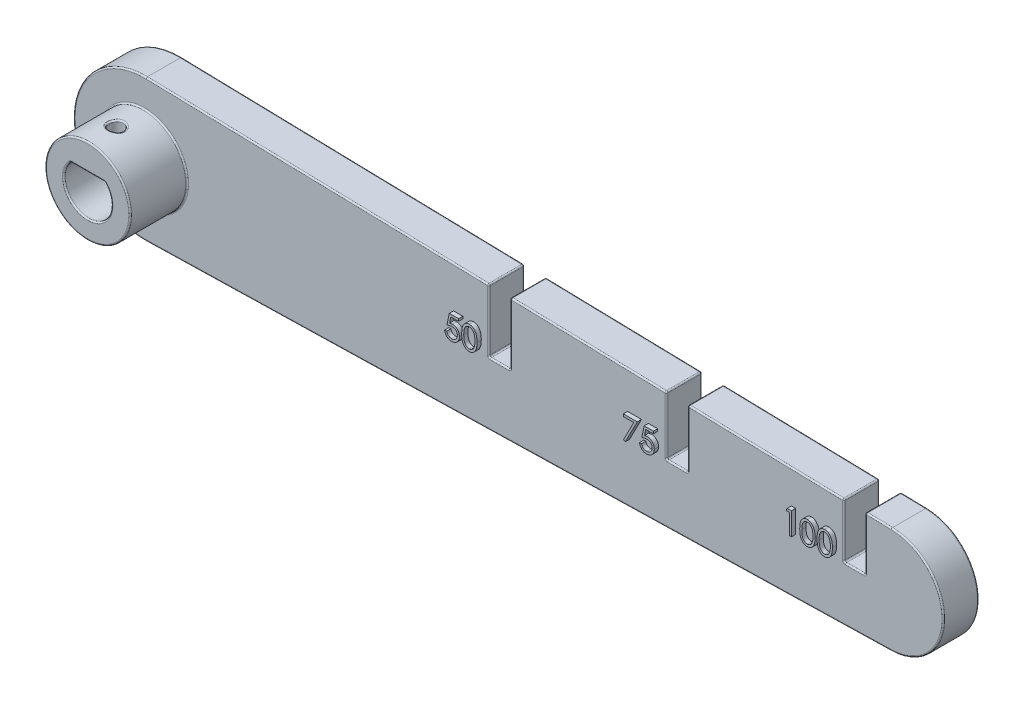
from build123d import *

# Parameters (mm, degrees)
BOSS_EXTRUDE1_DEPTH = 5
CUT_EXTRUDE2_REACH  = 115.054
CUT_EXTRUDE3_REACH  = 115.054
SKETCH4_W           = 3
SKETCH4_H           = 7.656932545
SKETCH4_H_2         = 8.25233943
SKETCH4_H_3         = 8.847746315
SKETCH6_R           = 6
BOSS_EXTRUDE3_DEPTH = 8
CUT_EXTRUDE4_REACH  = 115.689
SKETCH7_R           = 1
FILLET1_R           = 0.2
BOSS_EXTRUDE2_DEPTH = 0.6


with BuildPart() as part:
    # Sketch3 → Boss-Extrude1 (new body)
    with BuildSketch(Plane.XY):
        with BuildLine():
            Line((0.238095238, 9.997165131), (105.178571429, 7.497873848))
            ThreePointArc((105.178571429, 7.497873848), (112.5, 0), (105.178571429, -7.497873848))
            Line((105.178571429, -7.497873848), (0.238095238, -9.997165131))
            ThreePointArc((0.238095238, -9.997165131), (-10, 0), (0.238095238, 9.997165131))
        make_face()
    extrude(amount=BOSS_EXTRUDE1_DEPTH)

    # Sketch2 → Cut-Extrude2 (cut, up to next)
    with BuildSketch(Plane.XY, mode=Mode.PRIVATE) as cut_extrude2_sk1:
        with BuildLine():
            Line((-2.4, 2.337199179), (2.4, 2.337199179))
            ThreePointArc((2.4, 2.337199179), (0, -3.35), (-2.4, 2.337199179))
        make_face()
    cut_extrude2_tool1 = extrude(cut_extrude2_sk1.sketch, amount=CUT_EXTRUDE2_REACH, mode=Mode.PRIVATE) & part.part
    add(cut_extrude2_tool1.solids().sort_by_distance((0, -0.288877, 0))[0], mode=Mode.SUBTRACT)

    # Sketch4 → Cut-Extrude3 (cut, up to next)
    with BuildSketch(Plane.XY.offset(5), mode=Mode.PRIVATE) as cut_extrude3_sk1:
        with Locations((100, 3.828466273)):
            Rectangle(SKETCH4_W, SKETCH4_H)
    cut_extrude3_tool1 = extrude(cut_extrude3_sk1.sketch, amount=-CUT_EXTRUDE3_REACH, mode=Mode.PRIVATE) & part.part
    # Sketch4 → Cut-Extrude3 (cut, up to next)
    with BuildSketch(Plane.XY.offset(5), mode=Mode.PRIVATE) as cut_extrude3_sk2:
        with Locations((75, 4.126169715)):
            Rectangle(SKETCH4_W, SKETCH4_H_2)
    cut_extrude3_tool2 = extrude(cut_extrude3_sk2.sketch, amount=-CUT_EXTRUDE3_REACH, mode=Mode.PRIVATE) & part.part
    # Sketch4 → Cut-Extrude3 (cut, up to next)
    with BuildSketch(Plane.XY.offset(5), mode=Mode.PRIVATE) as cut_extrude3_sk3:
        with Locations((50, 4.423873158)):
            Rectangle(SKETCH4_W, SKETCH4_H_3)
    cut_extrude3_tool3 = extrude(cut_extrude3_sk3.sketch, amount=-CUT_EXTRUDE3_REACH, mode=Mode.PRIVATE) & part.part
    add(cut_extrude3_tool1.solids().sort_by_distance((100, 3.828466, 5))[0], mode=Mode.SUBTRACT)
    add(cut_extrude3_tool2.solids().sort_by_distance((75, 4.12617, 5))[0], mode=Mode.SUBTRACT)
    add(cut_extrude3_tool3.solids().sort_by_distance((50, 4.423873, 5))[0], mode=Mode.SUBTRACT)

    # Sketch6 → Boss-Extrude3 (add)
    with BuildSketch(Plane.XY.offset(5)):
        Circle(SKETCH6_R)
        with BuildLine():
            Line((-2.4, 2.337199179), (2.4, 2.337199179))
            ThreePointArc((2.4, 2.337199179), (0, -3.35), (-2.4, 2.337199179))
        make_face(mode=Mode.SUBTRACT)
    extrude(amount=BOSS_EXTRUDE3_DEPTH)

    # Sketch7 → Cut-Extrude4 (cut, up to next)
    with BuildSketch(Plane(origin=(0, 0, 0), x_dir=(1, 0, 0), z_dir=(0, 1, 0)), mode=Mode.PRIVATE) as cut_extrude4_sk1:
        with Locations((0, -9)):
            Circle(SKETCH7_R)
    cut_extrude4_tool1 = extrude(cut_extrude4_sk1.sketch, amount=CUT_EXTRUDE4_REACH, mode=Mode.PRIVATE) & part.part
    add(cut_extrude4_tool1.solids().sort_by_distance((0, 0, 9))[0], mode=Mode.SUBTRACT)

    # Fillet1
    fillet1_edges = [part.edges().sort_by_distance(p)[0] for p in [
        (51.5, 0, 2.5),
        (48.5, 0, 2.5),
        (101.5, 0, 2.5),
        (98.5, 0, 2.5),
        (76.5, 0, 2.5),
        (73.5, 0, 2.5),
        (0, 2.337199179, 0),
        (0, -3.35, 0),
        (76.5, 4.090445302, 0),
        (75, 0, 0),
        (73.5, 4.126169715, 0),
        (62.5, 8.51431846, 0),
        (51.5, 4.388148745, 0),
        (50, 0, 0),
        (48.5, 4.423873158, 0),
        (24.369047619, 9.422455723, 0),
        (-10, 0, 0),
        (52.708333333, -8.74751949, 0),
        (112.5, 0, 0),
        (103.339285714, 7.541678783, 0),
        (101.5, 3.792741859, 0),
        (100, 0, 0),
        (98.5, 3.828466272, 0),
        (87.5, 7.918911574, 0),
        (100, 0, 5),
        (101.5, 3.792741859, 5),
        (103.339285714, 7.541678783, 5),
        (112.5, 0, 5),
        (52.708333333, -8.74751949, 5),
        (-10, 0, 5),
        (24.369047619, 9.422455723, 5),
        (48.5, 4.423873158, 5),
        (50, 0, 5),
        (51.5, 4.388148745, 5),
        (62.5, 8.51431846, 5),
        (73.5, 4.126169715, 5),
        (75, 0, 5),
        (76.5, 4.090445302, 5),
        (87.5, 7.918911574, 5),
        (98.5, 3.828466272, 5),
        (101.5, 7.585483719, 2.5),
        (98.5, 7.656932545, 2.5),
        (76.5, 8.180890604, 2.5),
        (73.5, 8.25233943, 2.5),
        (51.5, 8.776297489, 2.5),
        (48.5, 8.847746315, 2.5),
        (-6, 0, 5),
        (0, 2.337199179, 13),
        (2.4, 2.337199179, 6.5),
        (0, -3.35, 13),
        (-2.4, 2.337199179, 6.5),
        (-1.000000007, 5.916079783, 9),
        (-1, 2.337199179, 9),
        (-6, 0, 13),
    ]]
    fillet(fillet1_edges, radius=FILLET1_R)

    # Sketch5 → Boss-Extrude2 (add)
    # profile 1 of 7: a face of its own
    with BuildSketch(Plane.XY.offset(5)):
        with BuildLine():
            Line((44.816666667, 3.175), (44.816666667, 2.849358974))
            Line((44.816666667, 2.849358974), (43.736708734, 2.849358974))
            Line((43.736708734, 2.849358974), (43.565619992, 2.014267829))
            add(Edge.make_bspline(
                [(43.565619992, 2.014267829), (43.599234964, 2.023548147), (43.664358655, 2.041527295), (43.760479386, 2.061489672), (43.851730885, 2.073523325), (43.910944971, 2.075166443), (43.939598357, 2.075961538)],
                knots=[0, 0, 0, 0, 1.100273476, 2.13160584, 3.095893838, 4, 4, 4, 4], degree=3))
            add(Edge.make_bspline(
                [(43.939598357, 2.075961538), (43.975052893, 2.075194154), (44.044765367, 2.073685284), (44.146763555, 2.059196535), (44.244129822, 2.036391041), (44.336660544, 2.004531711), (44.424526901, 1.963792167), (44.506920474, 1.912901507), (44.58507801, 1.853453414), (44.657597363, 1.785104724), (44.723387271, 1.709882972), (44.781232133, 1.629004046), (44.83036534, 1.543253952), (44.869881167, 1.4518134), (44.901435528, 1.355693311), (44.922437695, 1.253882325), (44.936422852, 1.147340102), (44.937985302, 1.074492385), (44.938782051, 1.037344752)],
                knots=[0, 0, 0, 0, 1.052922333, 2.070308379, 3.05430497, 4.020497103, 4.973039431, 5.925935799, 6.892292201, 7.88610001, 8.88166317, 9.857072816, 10.836096531, 11.812156883, 12.81219415, 13.836441305, 14.89672472, 16, 16, 16, 16], degree=3))
            add(Edge.make_bspline(
                [(44.938782051, 1.037344752), (44.938178733, 1.011471023), (44.93698025, 0.960073227), (44.930885531, 0.883742417), (44.919150989, 0.809027561), (44.903395982, 0.735918748), (44.882946788, 0.664554389), (44.858191718, 0.594730218), (44.82789675, 0.526880824), (44.79466686, 0.460364216), (44.757250412, 0.396684142), (44.715722766, 0.337131132), (44.671848356, 0.28081182), (44.624639385, 0.228330219), (44.573657054, 0.180031196), (44.519518798, 0.135628112), (44.462656617, 0.094370048), (44.40219079, 0.057931757), (44.339468681, 0.024401075), (44.273584512, -0.003106705), (44.20603802, -0.027699827), (44.135857025, -0.047302756), (44.063200495, -0.062663002), (43.987948663, -0.073095689), (43.910496198, -0.080694315), (43.857995294, -0.081169982), (43.831475361, -0.081410256)],
                knots=[0, 0, 0, 0, 1.056347294, 2.098418968, 3.122841568, 4.141288669, 5.149314143, 6.15115421, 7.162517403, 8.180376062, 9.185164535, 10.17417709, 11.141909838, 12.097768115, 13.052685741, 14.0056014, 14.954263652, 15.917497458, 16.885230207, 17.854509472, 18.828990115, 19.81800267, 20.826176721, 21.857883937, 22.917946725, 24, 24, 24, 24], degree=3))
            add(Edge.make_bspline(
                [(43.831475361, -0.081410256), (43.799839497, -0.080783568), (43.737599672, -0.079550632), (43.646413157, -0.066652434), (43.558679194, -0.048179453), (43.47510403, -0.02038798), (43.39493867, 0.014434781), (43.319262347, 0.058445879), (43.246141393, 0.10831978), (43.178548331, 0.167175529), (43.115813857, 0.231506183), (43.05965581, 0.301317758), (43.009641779, 0.375458038), (42.96657268, 0.454287077), (42.929835189, 0.537597745), (42.90097445, 0.625702181), (42.877680514, 0.718140042), (42.867825839, 0.781779298), (42.862820513, 0.814102564)],
                knots=[0, 0, 0, 0, 1.0467383, 2.05933395, 3.04377827, 4.011590433, 4.970194871, 5.932262533, 6.905835911, 7.896367577, 8.894135286, 9.877477877, 10.858688626, 11.851381753, 12.8477658, 13.868841284, 14.917554742, 16, 16, 16, 16], degree=3))
            Line((42.862820513, 0.814102564), (43.14775641, 0.814102564))
            add(Edge.make_bspline(
                [(43.14775641, 0.814102564), (43.154767316, 0.783825354), (43.168242666, 0.725630874), (43.197820738, 0.643868872), (43.233984782, 0.571007861), (43.276987298, 0.506084025), (43.328286254, 0.449470149), (43.386823665, 0.399017529), (43.452453385, 0.353501518), (43.525381529, 0.315562294), (43.602319108, 0.283205639), (43.682843649, 0.261659459), (43.764762592, 0.246509363), (43.820169399, 0.244992837), (43.848011819, 0.244230769)],
                knots=[0, 0, 0, 0, 1.136247022, 2.183929868, 3.172523383, 4.106158343, 5.02341133, 5.958108904, 6.928429099, 7.938127109, 8.96079061, 9.975095812, 10.982467395, 12, 12, 12, 12], degree=3))
            add(Edge.make_bspline(
                [(43.848011819, 0.244230769), (43.875188408, 0.244975332), (43.928699334, 0.246441382), (44.007449663, 0.257725343), (44.083479913, 0.275103997), (44.156039872, 0.301111651), (44.226399269, 0.332720789), (44.292778332, 0.37328375), (44.357097371, 0.419965339), (44.417357178, 0.473447424), (44.472547249, 0.532384219), (44.521311731, 0.59541014), (44.561930788, 0.662644708), (44.596161015, 0.732923925), (44.622153651, 0.807018045), (44.640696541, 0.884579825), (44.65158503, 0.965800843), (44.653082886, 1.021199431), (44.653846154, 1.049429087)],
                knots=[0, 0, 0, 0, 1.027316725, 2.022795036, 3.002884548, 3.971462791, 4.93288096, 5.914575861, 6.907176829, 7.935150275, 8.956128384, 9.956726525, 10.942570165, 11.921478529, 12.907843606, 13.90538589, 14.932640048, 16, 16, 16, 16], degree=3))
            add(Edge.make_bspline(
                [(44.653846154, 1.049429087), (44.653248819, 1.074897804), (44.652079621, 1.124749195), (44.642526889, 1.197682761), (44.625910778, 1.266691878), (44.602847687, 1.33210979), (44.573565563, 1.393998198), (44.537782122, 1.452420974), (44.494825825, 1.506608094), (44.445756755, 1.556584911), (44.392001246, 1.602708476), (44.332634423, 1.642027754), (44.268898632, 1.675105737), (44.201561781, 1.703651707), (44.129022195, 1.724153812), (44.052716392, 1.739546108), (43.971820379, 1.748450044), (43.916511254, 1.749685471), (43.888080929, 1.750320513)],
                knots=[0, 0, 0, 0, 1.045622112, 2.046656509, 3.013763289, 3.955457236, 4.890082067, 5.820317437, 6.762574623, 7.722996705, 8.69280354, 9.665887285, 10.63943826, 11.638615906, 12.663482002, 13.728887084, 14.832589034, 16, 16, 16, 16], degree=3))
            add(Edge.make_bspline(
                [(43.888080929, 1.750320513), (43.863471115, 1.749793834), (43.812658093, 1.748706375), (43.734713815, 1.740699481), (43.652806323, 1.727782407), (43.567249602, 1.710014883), (43.477786713, 1.686763834), (43.384606449, 1.658901395), (43.287512893, 1.625589296), (43.222091814, 1.600432216), (43.188461538, 1.5875)],
                knots=[0, 0, 0, 0, 0.817624296, 1.688186739, 2.600797293, 3.572016777, 4.590301741, 5.671205678, 6.80286297, 8, 8, 8, 8], degree=3))
            Line((43.188461538, 1.5875), (43.514102564, 3.175))
            Line((43.514102564, 3.175), (44.816666667, 3.175))
        make_face()
    # profile 2 of 7: a face of its own
    with BuildSketch(Plane.XY.offset(5)):
        with BuildLine():
            add(Edge.make_bspline(
                [(45.264423077, 1.586227965), (45.264720636, 1.637116309), (45.26529865, 1.735967652), (45.27172886, 1.880008006), (45.282410778, 2.015136268), (45.29704968, 2.141358907), (45.314864134, 2.258708507), (45.338645325, 2.366871466), (45.365689796, 2.466348394), (45.3970338, 2.557463681), (45.432401295, 2.641444883), (45.470895231, 2.719844887), (45.514043295, 2.792545069), (45.559379494, 2.860705779), (45.608739016, 2.923211273), (45.660717205, 2.98094426), (45.717342764, 3.032570441), (45.776690779, 3.079602444), (45.839298571, 3.120831607), (45.903381561, 3.15714702), (45.969380836, 3.188171185), (46.037476588, 3.212564652), (46.107056765, 3.232713063), (46.178364604, 3.246491609), (46.251517842, 3.25516109), (46.300894929, 3.255989917), (46.325936498, 3.256410256)],
                knots=[0, 0, 0, 0, 1.646270934, 3.197905019, 4.663502075, 6.030701355, 7.308322542, 8.50163776, 9.611534131, 10.641858119, 11.616356847, 12.558055219, 13.465016945, 14.349605745, 15.204443733, 16.039544428, 16.859896111, 17.680448484, 18.487036065, 19.28249412, 20.06191084, 20.843045899, 21.620316918, 22.403196591, 23.190181807, 24, 24, 24, 24], degree=3))
            add(Edge.make_bspline(
                [(46.325936498, 3.256410256), (46.351187254, 3.255967738), (46.401403062, 3.255087709), (46.475643974, 3.246629561), (46.548169756, 3.232595043), (46.618671211, 3.212709587), (46.687727449, 3.188039223), (46.754798333, 3.157117338), (46.820300471, 3.121122937), (46.883192946, 3.07882842), (46.944166204, 3.031673069), (47.001722571, 2.978366934), (47.055867284, 2.91944826), (47.107279883, 2.855547427), (47.154501746, 2.785438814), (47.199471931, 2.7103418), (47.239723706, 2.628943087), (47.278490162, 2.542600805), (47.311951928, 2.448925915), (47.342129165, 2.348446454), (47.366512229, 2.239975584), (47.386822498, 2.124082419), (47.402556796, 2.000341345), (47.414016407, 1.869017616), (47.420069849, 1.730024833), (47.421209856, 1.634994498), (47.421794872, 1.586227965)],
                knots=[0, 0, 0, 0, 0.810914788, 1.612654377, 2.396697861, 3.181598691, 3.963628158, 4.749916497, 5.551656086, 6.361998678, 7.18212741, 8.025565596, 8.878627764, 9.750805457, 10.657531673, 11.591944965, 12.560506719, 13.57287815, 14.630710178, 15.753379473, 16.941251878, 18.199788006, 19.531962791, 20.947069417, 22.433333509, 24, 24, 24, 24], degree=3))
            add(Edge.make_bspline(
                [(47.421794872, 1.586227965), (47.421203792, 1.537674134), (47.420052096, 1.443068975), (47.414084269, 1.30470159), (47.402328939, 1.174074794), (47.387624164, 1.050875303), (47.367257933, 0.935615891), (47.342216104, 0.827897713), (47.314411883, 0.727255591), (47.280090319, 0.634514012), (47.242524889, 0.548379235), (47.20165339, 0.467945464), (47.157865762, 0.392501756), (47.110160258, 0.322651986), (47.059311804, 0.257901347), (47.004232096, 0.199392789), (46.946473779, 0.145716537), (46.885321088, 0.097953989), (46.821447752, 0.056148487), (46.756170589, 0.018761637), (46.688331377, -0.011385165), (46.619467484, -0.037270523), (46.548593895, -0.057046647), (46.475798955, -0.070720788), (46.401452941, -0.080310965), (46.351195807, -0.081042557), (46.325936498, -0.081410256)],
                knots=[0, 0, 0, 0, 1.561518951, 3.042555995, 4.452378317, 5.7783523, 7.031515105, 8.214008947, 9.334062868, 10.386615937, 11.391082383, 12.354592575, 13.286541444, 14.194233754, 15.072674879, 15.931287219, 16.775624067, 17.606195743, 18.42308326, 19.229000347, 20.022332153, 20.807536673, 21.593273796, 22.3848459, 23.188221202, 24, 24, 24, 24], degree=3))
            add(Edge.make_bspline(
                [(46.325936498, -0.081410256), (46.300895624, -0.080987205), (46.251519906, -0.080153031), (46.178356634, -0.071522718), (46.107343275, -0.057647511), (46.038129405, -0.038219592), (45.970359924, -0.01443899), (45.904958292, 0.01654328), (45.841197322, 0.052224899), (45.779247125, 0.092860746), (45.720271807, 0.139416844), (45.663939501, 0.190910163), (45.611665377, 0.248625686), (45.56301159, 0.311652088), (45.51677081, 0.379409529), (45.47423545, 0.452823125), (45.434891889, 0.531601779), (45.39892958, 0.616254455), (45.367044721, 0.708016425), (45.338880014, 0.807937466), (45.316642171, 0.916899507), (45.297607633, 1.034027404), (45.2822548, 1.15982447), (45.271773376, 1.294358997), (45.265295184, 1.437547151), (45.264719084, 1.535763303), (45.264423077, 1.586227965)],
                knots=[0, 0, 0, 0, 0.810891512, 1.598919785, 2.382837074, 3.152667961, 3.926044502, 4.706494248, 5.493654104, 6.291793342, 7.103789334, 7.925228297, 8.761435821, 9.622817696, 10.50288917, 11.416980706, 12.369136599, 13.353924996, 14.394355917, 15.514179734, 16.714354668, 17.994756427, 19.357759367, 20.818452758, 22.365282078, 24, 24, 24, 24], degree=3))
        make_face()
        with BuildLine():
            add(Edge.make_bspline(
                [(45.549358974, 1.5875), (45.54946733, 1.545092252), (45.549677627, 1.46278714), (45.555171466, 1.343186467), (45.562655605, 1.231634812), (45.572308782, 1.127990532), (45.586644313, 1.03260445), (45.6027069, 0.944820523), (45.622254095, 0.865103315), (45.645381719, 0.792905801), (45.671724328, 0.727002717), (45.700486076, 0.665678758), (45.731384017, 0.608209501), (45.765963532, 0.555111156), (45.803623625, 0.506210565), (45.843513653, 0.46064221), (45.887122355, 0.420004948), (45.94745075, 0.371267015), (46.027094694, 0.32090323), (46.12744325, 0.27704642), (46.230556774, 0.249485191), (46.300543979, 0.245980213), (46.335476763, 0.244230769)],
                knots=[0, 0, 0, 0, 1.459021318, 2.831673884, 4.118529203, 5.306027144, 6.411944654, 7.436330062, 8.375795394, 9.233974572, 10.042671642, 10.816086306, 11.563610507, 12.285937304, 12.993564865, 13.685989202, 14.367179055, 15.041617293, 16.353048772, 17.594441528, 18.799311195, 20, 20, 20, 20], degree=3))
            add(Edge.make_bspline(
                [(46.335476763, 0.244230769), (46.370635508, 0.245680185), (46.440880408, 0.248576023), (46.543508922, 0.276514878), (46.643140667, 0.318669388), (46.721220213, 0.368514626), (46.780622235, 0.415983896), (46.823182647, 0.456455755), (46.862246077, 0.501772864), (46.899295673, 0.550667225), (46.933276406, 0.604072978), (46.964176538, 0.661733315), (46.992373575, 0.723808354), (47.00843821, 0.767142332), (47.016651643, 0.789297877)],
                knots=[0, 0, 0, 0, 1.353760809, 2.704726607, 4.075137775, 5.516104923, 6.260822281, 7.007110065, 7.778089737, 8.566572457, 9.372053459, 10.217411131, 11.088608312, 12, 12, 12, 12], degree=3))
            add(Edge.make_bspline(
                [(47.016651643, 0.789297877), (47.026223603, 0.817627712), (47.045658789, 0.875149426), (47.070706613, 0.964379311), (47.090432796, 1.057998961), (47.108179564, 1.155448888), (47.120292693, 1.25744776), (47.130042495, 1.36367998), (47.135785332, 1.474225644), (47.136497214, 1.549332529), (47.136858974, 1.5875)],
                knots=[0, 0, 0, 0, 0.884706709, 1.796334032, 2.740027952, 3.714592787, 4.726048262, 5.777819803, 6.87074269, 8, 8, 8, 8], degree=3))
            add(Edge.make_bspline(
                [(47.136858974, 1.5875), (47.136359874, 1.625661298), (47.135383527, 1.700312955), (47.131651553, 1.809640161), (47.122014453, 1.913478773), (47.111310967, 2.01227613), (47.095529202, 2.105485333), (47.078513191, 2.193886682), (47.055652092, 2.276384997), (47.03123201, 2.354271903), (47.00328258, 2.426662497), (46.972516164, 2.493894289), (46.939657854, 2.556291861), (46.903968822, 2.613684015), (46.865872738, 2.666327822), (46.824364104, 2.713167775), (46.781089423, 2.755655596), (46.72047669, 2.804153784), (46.641125013, 2.853603679), (46.542386461, 2.89911119), (46.439633805, 2.925244427), (46.370170743, 2.928928957), (46.335476763, 2.930769231)],
                knots=[0, 0, 0, 0, 1.31362396, 2.569729283, 3.763502607, 4.902122613, 5.988968491, 7.01645872, 7.998833611, 8.933434873, 9.825090667, 10.667526885, 11.477055099, 12.250526234, 12.991942729, 13.710640831, 14.402115721, 15.076753259, 16.378508321, 17.609869233, 18.806226677, 20, 20, 20, 20], degree=3))
            add(Edge.make_bspline(
                [(46.335476763, 2.930769231), (46.300360726, 2.928926418), (46.230064678, 2.925237437), (46.126244034, 2.899208557), (46.026726515, 2.853839652), (45.947584674, 2.80399), (45.886929667, 2.756511674), (45.844218938, 2.715339677), (45.804172053, 2.670303432), (45.76728064, 2.620953123), (45.732728219, 2.567916683), (45.700995443, 2.510776875), (45.672404722, 2.449244137), (45.646020893, 2.383370657), (45.622822721, 2.311179371), (45.603687483, 2.231560356), (45.586009942, 2.144055639), (45.573495662, 2.048152943), (45.562370684, 1.944482704), (45.555221175, 1.832652565), (45.549659249, 1.712851306), (45.549461071, 1.630120641), (45.549358974, 1.5875)],
                knots=[0, 0, 0, 0, 1.207732386, 2.417664972, 3.655092373, 4.956220595, 5.625982001, 6.301752483, 6.994047911, 7.697131622, 8.419323945, 9.170223765, 9.943494443, 10.752040957, 11.610060368, 12.549350801, 13.567764191, 14.679664412, 15.874934091, 17.154273443, 18.533957287, 20, 20, 20, 20], degree=3))
        make_face(mode=Mode.SUBTRACT)
    # profile 3 of 7: a face of its own
    with BuildSketch(Plane.XY.offset(5)):
        Polygon((68.025641026, 3.175), (69.979487179, 3.175), (68.310576923, -0.081410256), (68.064438101, 0.054061498), (69.497385817, 2.849358974), (68.025641026, 2.849358974), align=None)
    # profile 4 of 7: a face of its own
    with BuildSketch(Plane.XY.offset(5)):
        with BuildLine():
            Line((72.258974359, 3.175), (72.258974359, 2.849358974))
            Line((72.258974359, 2.849358974), (71.179016426, 2.849358974))
            Line((71.179016426, 2.849358974), (71.007927684, 2.014267829))
            add(Edge.make_bspline(
                [(71.007927684, 2.014267829), (71.041542656, 2.023548147), (71.106666347, 2.041527295), (71.202787078, 2.061489672), (71.294038577, 2.073523325), (71.353252663, 2.075166443), (71.38190605, 2.075961538)],
                knots=[0, 0, 0, 0, 1.100273476, 2.13160584, 3.095893838, 4, 4, 4, 4], degree=3))
            add(Edge.make_bspline(
                [(71.38190605, 2.075961538), (71.417360585, 2.075194154), (71.48707306, 2.073685284), (71.589071247, 2.059196535), (71.686437515, 2.036391041), (71.778968236, 2.004531711), (71.866834593, 1.963792167), (71.949228167, 1.912901507), (72.027385702, 1.853453414), (72.099905055, 1.785104724), (72.165694963, 1.709882972), (72.223539825, 1.629004046), (72.272673032, 1.543253952), (72.31218886, 1.4518134), (72.34374322, 1.355693311), (72.364745387, 1.253882325), (72.378730544, 1.147340102), (72.380292995, 1.074492385), (72.381089744, 1.037344752)],
                knots=[0, 0, 0, 0, 1.052922333, 2.070308379, 3.05430497, 4.020497103, 4.973039431, 5.925935799, 6.892292201, 7.88610001, 8.88166317, 9.857072816, 10.836096531, 11.812156883, 12.81219415, 13.836441305, 14.89672472, 16, 16, 16, 16], degree=3))
            add(Edge.make_bspline(
                [(72.381089744, 1.037344752), (72.380486425, 1.011471023), (72.379287942, 0.960073227), (72.373193223, 0.883742417), (72.361458681, 0.809027561), (72.345703674, 0.735918748), (72.325254481, 0.664554389), (72.30049941, 0.594730218), (72.270204442, 0.526880824), (72.236974552, 0.460364216), (72.199558104, 0.396684142), (72.158030458, 0.337131132), (72.114156048, 0.28081182), (72.066947077, 0.228330219), (72.015964746, 0.180031196), (71.96182649, 0.135628112), (71.904964309, 0.094370048), (71.844498482, 0.057931757), (71.781776373, 0.024401075), (71.715892204, -0.003106705), (71.648345712, -0.027699827), (71.578164718, -0.047302756), (71.505508188, -0.062663002), (71.430256356, -0.073095689), (71.352803891, -0.080694315), (71.300302986, -0.081169982), (71.273783053, -0.081410256)],
                knots=[0, 0, 0, 0, 1.056347294, 2.098418968, 3.122841568, 4.141288669, 5.149314143, 6.15115421, 7.162517403, 8.180376062, 9.185164535, 10.17417709, 11.141909838, 12.097768115, 13.052685741, 14.0056014, 14.954263652, 15.917497458, 16.885230207, 17.854509472, 18.828990115, 19.81800267, 20.826176721, 21.857883937, 22.917946725, 24, 24, 24, 24], degree=3))
            add(Edge.make_bspline(
                [(71.273783053, -0.081410256), (71.242147189, -0.080783568), (71.179907364, -0.079550632), (71.08872085, -0.066652434), (71.000986886, -0.048179453), (70.917411723, -0.02038798), (70.837246362, 0.014434781), (70.761570039, 0.058445879), (70.688449085, 0.10831978), (70.620856024, 0.167175529), (70.558121549, 0.231506183), (70.501963502, 0.301317758), (70.451949471, 0.375458038), (70.408880372, 0.454287077), (70.372142882, 0.537597745), (70.343282142, 0.625702181), (70.319988206, 0.718140042), (70.310133532, 0.781779298), (70.305128205, 0.814102564)],
                knots=[0, 0, 0, 0, 1.0467383, 2.05933395, 3.04377827, 4.011590433, 4.970194871, 5.932262533, 6.905835911, 7.896367577, 8.894135286, 9.877477877, 10.858688626, 11.851381753, 12.8477658, 13.868841284, 14.917554742, 16, 16, 16, 16], degree=3))
            Line((70.305128205, 0.814102564), (70.590064103, 0.814102564))
            add(Edge.make_bspline(
                [(70.590064103, 0.814102564), (70.597075008, 0.783825354), (70.610550358, 0.725630874), (70.64012843, 0.643868872), (70.676292474, 0.571007861), (70.71929499, 0.506084025), (70.770593947, 0.449470149), (70.829131357, 0.399017529), (70.894761078, 0.353501518), (70.967689221, 0.315562294), (71.044626801, 0.283205639), (71.125151341, 0.261659459), (71.207070284, 0.246509363), (71.262477091, 0.244992837), (71.290319511, 0.244230769)],
                knots=[0, 0, 0, 0, 1.136247022, 2.183929868, 3.172523383, 4.106158343, 5.02341133, 5.958108904, 6.928429099, 7.938127109, 8.96079061, 9.975095812, 10.982467395, 12, 12, 12, 12], degree=3))
            add(Edge.make_bspline(
                [(71.290319511, 0.244230769), (71.3174961, 0.244975332), (71.371007026, 0.246441382), (71.449757355, 0.257725343), (71.525787605, 0.275103997), (71.598347565, 0.301111651), (71.668706961, 0.332720789), (71.735086025, 0.37328375), (71.799405063, 0.419965339), (71.85966487, 0.473447424), (71.914854942, 0.532384219), (71.963619423, 0.59541014), (72.00423848, 0.662644708), (72.038468708, 0.732923925), (72.064461343, 0.807018045), (72.083004233, 0.884579825), (72.093892722, 0.965800843), (72.095390578, 1.021199431), (72.096153846, 1.049429087)],
                knots=[0, 0, 0, 0, 1.027316725, 2.022795036, 3.002884548, 3.971462791, 4.93288096, 5.914575861, 6.907176829, 7.935150275, 8.956128384, 9.956726525, 10.942570165, 11.921478529, 12.907843606, 13.90538589, 14.932640048, 16, 16, 16, 16], degree=3))
            add(Edge.make_bspline(
                [(72.096153846, 1.049429087), (72.095556511, 1.074897804), (72.094387313, 1.124749195), (72.084834581, 1.197682761), (72.068218471, 1.266691878), (72.04515538, 1.33210979), (72.015873255, 1.393998198), (71.980089814, 1.452420974), (71.937133518, 1.506608094), (71.888064447, 1.556584911), (71.834308939, 1.602708476), (71.774942115, 1.642027754), (71.711206324, 1.675105737), (71.643869473, 1.703651707), (71.571329887, 1.724153812), (71.495024085, 1.739546108), (71.414128071, 1.748450044), (71.358818947, 1.749685471), (71.330388622, 1.750320513)],
                knots=[0, 0, 0, 0, 1.045622112, 2.046656509, 3.013763289, 3.955457236, 4.890082067, 5.820317437, 6.762574623, 7.722996705, 8.69280354, 9.665887285, 10.63943826, 11.638615906, 12.663482002, 13.728887084, 14.832589034, 16, 16, 16, 16], degree=3))
            add(Edge.make_bspline(
                [(71.330388622, 1.750320513), (71.305778808, 1.749793834), (71.254965785, 1.748706375), (71.177021507, 1.740699481), (71.095114015, 1.727782407), (71.009557294, 1.710014883), (70.920094405, 1.686763834), (70.826914141, 1.658901395), (70.729820585, 1.625589296), (70.664399507, 1.600432216), (70.630769231, 1.5875)],
                knots=[0, 0, 0, 0, 0.817624296, 1.688186739, 2.600797293, 3.572016777, 4.590301741, 5.671205678, 6.80286297, 8, 8, 8, 8], degree=3))
            Line((70.630769231, 1.5875), (70.956410256, 3.175))
            Line((70.956410256, 3.175), (72.258974359, 3.175))
        make_face()
    # profile 5 of 7: a face of its own
    with BuildSketch(Plane.XY.offset(5)):
        Polygon((91.096930088, 3.175), (91.683974359, 3.175), (91.683974359, 0), (91.399038462, 0), (91.399038462, 2.849358974), (90.910576923, 2.849358974), align=None)
    # profile 6 of 7: a face of its own
    with BuildSketch(Plane.XY.offset(5)):
        with BuildLine():
            add(Edge.make_bspline(
                [(92.864423077, 1.586227965), (92.864720636, 1.637116309), (92.86529865, 1.735967652), (92.87172886, 1.880008006), (92.882410778, 2.015136268), (92.89704968, 2.141358907), (92.914864134, 2.258708507), (92.938645325, 2.366871466), (92.965689796, 2.466348394), (92.9970338, 2.557463681), (93.032401295, 2.641444883), (93.070895231, 2.719844887), (93.114043295, 2.792545069), (93.159379494, 2.860705779), (93.208739016, 2.923211273), (93.260717205, 2.98094426), (93.317342764, 3.032570441), (93.376690779, 3.079602444), (93.439298571, 3.120831607), (93.503381561, 3.15714702), (93.569380836, 3.188171185), (93.637476588, 3.212564652), (93.707056765, 3.232713063), (93.778364604, 3.246491609), (93.851517842, 3.25516109), (93.900894929, 3.255989917), (93.925936498, 3.256410256)],
                knots=[0, 0, 0, 0, 1.646270934, 3.197905019, 4.663502075, 6.030701355, 7.308322542, 8.50163776, 9.611534131, 10.641858119, 11.616356847, 12.558055219, 13.465016945, 14.349605745, 15.204443733, 16.039544428, 16.859896111, 17.680448484, 18.487036065, 19.28249412, 20.06191084, 20.843045899, 21.620316918, 22.403196591, 23.190181807, 24, 24, 24, 24], degree=3))
            add(Edge.make_bspline(
                [(93.925936498, 3.256410256), (93.951187254, 3.255967738), (94.001403062, 3.255087709), (94.075643974, 3.246629561), (94.148169756, 3.232595043), (94.218671211, 3.212709587), (94.287727449, 3.188039223), (94.354798333, 3.157117338), (94.420300471, 3.121122937), (94.483192946, 3.07882842), (94.544166204, 3.031673069), (94.601722571, 2.978366934), (94.655867284, 2.91944826), (94.707279883, 2.855547427), (94.754501746, 2.785438814), (94.799471931, 2.7103418), (94.839723706, 2.628943087), (94.878490162, 2.542600805), (94.911951928, 2.448925915), (94.942129165, 2.348446454), (94.966512229, 2.239975584), (94.986822498, 2.124082419), (95.002556796, 2.000341345), (95.014016407, 1.869017616), (95.020069849, 1.730024833), (95.021209856, 1.634994498), (95.021794872, 1.586227965)],
                knots=[0, 0, 0, 0, 0.810914788, 1.612654377, 2.396697861, 3.181598691, 3.963628158, 4.749916497, 5.551656086, 6.361998678, 7.18212741, 8.025565596, 8.878627764, 9.750805457, 10.657531673, 11.591944965, 12.560506719, 13.57287815, 14.630710178, 15.753379473, 16.941251878, 18.199788006, 19.531962791, 20.947069417, 22.433333509, 24, 24, 24, 24], degree=3))
            add(Edge.make_bspline(
                [(95.021794872, 1.586227965), (95.021203792, 1.537674134), (95.020052096, 1.443068975), (95.014084269, 1.30470159), (95.002328939, 1.174074794), (94.987624164, 1.050875303), (94.967257933, 0.935615891), (94.942216104, 0.827897713), (94.914411883, 0.727255591), (94.880090319, 0.634514012), (94.842524889, 0.548379235), (94.80165339, 0.467945464), (94.757865762, 0.392501756), (94.710160258, 0.322651986), (94.659311804, 0.257901347), (94.604232096, 0.199392789), (94.546473779, 0.145716537), (94.485321088, 0.097953989), (94.421447752, 0.056148487), (94.356170589, 0.018761637), (94.288331377, -0.011385165), (94.219467484, -0.037270523), (94.148593895, -0.057046647), (94.075798955, -0.070720788), (94.001452941, -0.080310965), (93.951195807, -0.081042557), (93.925936498, -0.081410256)],
                knots=[0, 0, 0, 0, 1.561518951, 3.042555995, 4.452378317, 5.7783523, 7.031515105, 8.214008947, 9.334062868, 10.386615937, 11.391082383, 12.354592575, 13.286541444, 14.194233754, 15.072674879, 15.931287219, 16.775624067, 17.606195743, 18.42308326, 19.229000347, 20.022332153, 20.807536673, 21.593273796, 22.3848459, 23.188221202, 24, 24, 24, 24], degree=3))
            add(Edge.make_bspline(
                [(93.925936498, -0.081410256), (93.900895624, -0.080987205), (93.851519906, -0.080153031), (93.778356634, -0.071522718), (93.707343275, -0.057647511), (93.638129405, -0.038219592), (93.570359924, -0.01443899), (93.504958292, 0.01654328), (93.441197322, 0.052224899), (93.379247125, 0.092860746), (93.320271807, 0.139416844), (93.263939501, 0.190910163), (93.211665377, 0.248625686), (93.16301159, 0.311652088), (93.11677081, 0.379409529), (93.07423545, 0.452823125), (93.034891889, 0.531601779), (92.99892958, 0.616254455), (92.967044721, 0.708016425), (92.938880014, 0.807937466), (92.916642171, 0.916899507), (92.897607633, 1.034027404), (92.8822548, 1.15982447), (92.871773376, 1.294358997), (92.865295184, 1.437547151), (92.864719084, 1.535763303), (92.864423077, 1.586227965)],
                knots=[0, 0, 0, 0, 0.810891512, 1.598919785, 2.382837074, 3.152667961, 3.926044502, 4.706494248, 5.493654104, 6.291793342, 7.103789334, 7.925228297, 8.761435821, 9.622817696, 10.50288917, 11.416980706, 12.369136599, 13.353924996, 14.394355917, 15.514179734, 16.714354668, 17.994756427, 19.357759367, 20.818452758, 22.365282078, 24, 24, 24, 24], degree=3))
        make_face()
        with BuildLine():
            add(Edge.make_bspline(
                [(93.149358974, 1.5875), (93.14946733, 1.545092252), (93.149677627, 1.46278714), (93.155171466, 1.343186467), (93.162655605, 1.231634812), (93.172308782, 1.127990532), (93.186644313, 1.03260445), (93.2027069, 0.944820523), (93.222254095, 0.865103315), (93.245381719, 0.792905801), (93.271724328, 0.727002717), (93.300486076, 0.665678758), (93.331384017, 0.608209501), (93.365963532, 0.555111156), (93.403623625, 0.506210565), (93.443513653, 0.46064221), (93.487122355, 0.420004948), (93.54745075, 0.371267015), (93.627094694, 0.32090323), (93.72744325, 0.27704642), (93.830556774, 0.249485191), (93.900543979, 0.245980213), (93.935476763, 0.244230769)],
                knots=[0, 0, 0, 0, 1.459021318, 2.831673884, 4.118529203, 5.306027144, 6.411944654, 7.436330062, 8.375795394, 9.233974572, 10.042671642, 10.816086306, 11.563610507, 12.285937304, 12.993564865, 13.685989202, 14.367179055, 15.041617293, 16.353048772, 17.594441528, 18.799311195, 20, 20, 20, 20], degree=3))
            add(Edge.make_bspline(
                [(93.935476763, 0.244230769), (93.970635508, 0.245680185), (94.040880408, 0.248576023), (94.143508922, 0.276514878), (94.243140667, 0.318669388), (94.321220213, 0.368514626), (94.380622235, 0.415983896), (94.423182647, 0.456455755), (94.462246077, 0.501772864), (94.499295673, 0.550667225), (94.533276406, 0.604072978), (94.564176538, 0.661733315), (94.592373575, 0.723808354), (94.60843821, 0.767142332), (94.616651643, 0.789297877)],
                knots=[0, 0, 0, 0, 1.353760809, 2.704726607, 4.075137775, 5.516104923, 6.260822281, 7.007110065, 7.778089737, 8.566572457, 9.372053459, 10.217411131, 11.088608312, 12, 12, 12, 12], degree=3))
            add(Edge.make_bspline(
                [(94.616651643, 0.789297877), (94.626223603, 0.817627712), (94.645658789, 0.875149426), (94.670706613, 0.964379311), (94.690432796, 1.057998961), (94.708179564, 1.155448888), (94.720292693, 1.25744776), (94.730042495, 1.36367998), (94.735785332, 1.474225644), (94.736497214, 1.549332529), (94.736858974, 1.5875)],
                knots=[0, 0, 0, 0, 0.884706709, 1.796334032, 2.740027952, 3.714592787, 4.726048262, 5.777819803, 6.87074269, 8, 8, 8, 8], degree=3))
            add(Edge.make_bspline(
                [(94.736858974, 1.5875), (94.736359874, 1.625661298), (94.735383527, 1.700312955), (94.731651553, 1.809640161), (94.722014453, 1.913478773), (94.711310967, 2.01227613), (94.695529202, 2.105485333), (94.678513191, 2.193886682), (94.655652092, 2.276384997), (94.63123201, 2.354271903), (94.60328258, 2.426662497), (94.572516164, 2.493894289), (94.539657854, 2.556291861), (94.503968822, 2.613684015), (94.465872738, 2.666327822), (94.424364104, 2.713167775), (94.381089423, 2.755655596), (94.32047669, 2.804153784), (94.241125013, 2.853603679), (94.142386461, 2.89911119), (94.039633805, 2.925244427), (93.970170743, 2.928928957), (93.935476763, 2.930769231)],
                knots=[0, 0, 0, 0, 1.31362396, 2.569729283, 3.763502607, 4.902122613, 5.988968491, 7.01645872, 7.998833611, 8.933434873, 9.825090667, 10.667526885, 11.477055099, 12.250526234, 12.991942729, 13.710640831, 14.402115721, 15.076753259, 16.378508321, 17.609869233, 18.806226677, 20, 20, 20, 20], degree=3))
            add(Edge.make_bspline(
                [(93.935476763, 2.930769231), (93.900360726, 2.928926418), (93.830064678, 2.925237437), (93.726244034, 2.899208557), (93.626726515, 2.853839652), (93.547584674, 2.80399), (93.486929667, 2.756511674), (93.444218938, 2.715339677), (93.404172053, 2.670303432), (93.36728064, 2.620953123), (93.332728219, 2.567916683), (93.300995443, 2.510776875), (93.272404722, 2.449244137), (93.246020893, 2.383370657), (93.222822721, 2.311179371), (93.203687483, 2.231560356), (93.186009942, 2.144055639), (93.173495662, 2.048152943), (93.162370684, 1.944482704), (93.155221175, 1.832652565), (93.149659249, 1.712851306), (93.149461071, 1.630120641), (93.149358974, 1.5875)],
                knots=[0, 0, 0, 0, 1.207732386, 2.417664972, 3.655092373, 4.956220595, 5.625982001, 6.301752483, 6.994047911, 7.697131622, 8.419323945, 9.170223765, 9.943494443, 10.752040957, 11.610060368, 12.549350801, 13.567764191, 14.679664412, 15.874934091, 17.154273443, 18.533957287, 20, 20, 20, 20], degree=3))
        make_face(mode=Mode.SUBTRACT)
    # profile 7 of 7: a face of its own
    with BuildSketch(Plane.XY.offset(5)):
        with BuildLine():
            add(Edge.make_bspline(
                [(95.306730769, 1.586227965), (95.307028329, 1.637116309), (95.307606342, 1.735967652), (95.314036552, 1.880008006), (95.32471847, 2.015136268), (95.339357372, 2.141358907), (95.357171826, 2.258708507), (95.380953017, 2.366871466), (95.407997488, 2.466348394), (95.439341493, 2.557463681), (95.474708987, 2.641444883), (95.513202924, 2.719844887), (95.556350987, 2.792545069), (95.601687187, 2.860705779), (95.651046709, 2.923211273), (95.703024897, 2.98094426), (95.759650456, 3.032570441), (95.818998471, 3.079602444), (95.881606264, 3.120831607), (95.945689254, 3.15714702), (96.011688528, 3.188171185), (96.07978428, 3.212564652), (96.149364458, 3.232713063), (96.220672297, 3.246491609), (96.293825534, 3.25516109), (96.343202621, 3.255989917), (96.368244191, 3.256410256)],
                knots=[0, 0, 0, 0, 1.646270934, 3.197905019, 4.663502075, 6.030701355, 7.308322542, 8.50163776, 9.611534131, 10.641858119, 11.616356847, 12.558055219, 13.465016945, 14.349605745, 15.204443733, 16.039544428, 16.859896111, 17.680448484, 18.487036065, 19.28249412, 20.06191084, 20.843045899, 21.620316918, 22.403196591, 23.190181807, 24, 24, 24, 24], degree=3))
            add(Edge.make_bspline(
                [(96.368244191, 3.256410256), (96.393494946, 3.255967738), (96.443710754, 3.255087709), (96.517951666, 3.246629561), (96.590477449, 3.232595043), (96.660978903, 3.212709587), (96.730035141, 3.188039223), (96.797106025, 3.157117338), (96.862608163, 3.121122937), (96.925500638, 3.07882842), (96.986473897, 3.031673069), (97.044030263, 2.978366934), (97.098174977, 2.91944826), (97.149587575, 2.855547427), (97.196809438, 2.785438814), (97.241779623, 2.7103418), (97.282031399, 2.628943087), (97.320797854, 2.542600805), (97.354259621, 2.448925915), (97.384436857, 2.348446454), (97.408819922, 2.239975584), (97.42913019, 2.124082419), (97.444864489, 2.000341345), (97.4563241, 1.869017616), (97.462377541, 1.730024833), (97.463517549, 1.634994498), (97.464102564, 1.586227965)],
                knots=[0, 0, 0, 0, 0.810914788, 1.612654377, 2.396697861, 3.181598691, 3.963628158, 4.749916497, 5.551656086, 6.361998678, 7.18212741, 8.025565596, 8.878627764, 9.750805457, 10.657531673, 11.591944965, 12.560506719, 13.57287815, 14.630710178, 15.753379473, 16.941251878, 18.199788006, 19.531962791, 20.947069417, 22.433333509, 24, 24, 24, 24], degree=3))
            add(Edge.make_bspline(
                [(97.464102564, 1.586227965), (97.463511484, 1.537674134), (97.462359788, 1.443068975), (97.456391961, 1.30470159), (97.444636631, 1.174074794), (97.429931856, 1.050875303), (97.409565626, 0.935615891), (97.384523796, 0.827897713), (97.356719575, 0.727255591), (97.322398012, 0.634514012), (97.284832582, 0.548379235), (97.243961082, 0.467945464), (97.200173454, 0.392501756), (97.15246795, 0.322651986), (97.101619496, 0.257901347), (97.046539788, 0.199392789), (96.988781472, 0.145716537), (96.92762878, 0.097953989), (96.863755444, 0.056148487), (96.798478282, 0.018761637), (96.73063907, -0.011385165), (96.661775177, -0.037270523), (96.590901587, -0.057046647), (96.518106647, -0.070720788), (96.443760633, -0.080310965), (96.393503499, -0.081042557), (96.368244191, -0.081410256)],
                knots=[0, 0, 0, 0, 1.561518951, 3.042555995, 4.452378317, 5.7783523, 7.031515105, 8.214008947, 9.334062868, 10.386615937, 11.391082383, 12.354592575, 13.286541444, 14.194233754, 15.072674879, 15.931287219, 16.775624067, 17.606195743, 18.42308326, 19.229000347, 20.022332153, 20.807536673, 21.593273796, 22.3848459, 23.188221202, 24, 24, 24, 24], degree=3))
            add(Edge.make_bspline(
                [(96.368244191, -0.081410256), (96.343203316, -0.080987205), (96.293827598, -0.080153031), (96.220664327, -0.071522718), (96.149650967, -0.057647511), (96.080437098, -0.038219592), (96.012667616, -0.01443899), (95.947265985, 0.01654328), (95.883505014, 0.052224899), (95.821554817, 0.092860746), (95.7625795, 0.139416844), (95.706247193, 0.190910163), (95.653973069, 0.248625686), (95.605319282, 0.311652088), (95.559078502, 0.379409529), (95.516543142, 0.452823125), (95.477199582, 0.531601779), (95.441237272, 0.616254455), (95.409352413, 0.708016425), (95.381187707, 0.807937466), (95.358949864, 0.916899507), (95.339915326, 1.034027404), (95.324562492, 1.15982447), (95.314081069, 1.294358997), (95.307602876, 1.437547151), (95.307026776, 1.535763303), (95.306730769, 1.586227965)],
                knots=[0, 0, 0, 0, 0.810891512, 1.598919785, 2.382837074, 3.152667961, 3.926044502, 4.706494248, 5.493654104, 6.291793342, 7.103789334, 7.925228297, 8.761435821, 9.622817696, 10.50288917, 11.416980706, 12.369136599, 13.353924996, 14.394355917, 15.514179734, 16.714354668, 17.994756427, 19.357759367, 20.818452758, 22.365282078, 24, 24, 24, 24], degree=3))
        make_face()
        with BuildLine():
            add(Edge.make_bspline(
                [(95.591666667, 1.5875), (95.591775022, 1.545092252), (95.591985319, 1.46278714), (95.597479158, 1.343186467), (95.604963297, 1.231634812), (95.614616474, 1.127990532), (95.628952006, 1.03260445), (95.645014592, 0.944820523), (95.664561787, 0.865103315), (95.687689411, 0.792905801), (95.71403202, 0.727002717), (95.742793768, 0.665678758), (95.773691709, 0.608209501), (95.808271225, 0.555111156), (95.845931318, 0.506210565), (95.885821346, 0.46064221), (95.929430047, 0.420004948), (95.989758442, 0.371267015), (96.069402387, 0.32090323), (96.169750942, 0.27704642), (96.272864466, 0.249485191), (96.342851671, 0.245980213), (96.377784455, 0.244230769)],
                knots=[0, 0, 0, 0, 1.459021318, 2.831673884, 4.118529203, 5.306027144, 6.411944654, 7.436330062, 8.375795394, 9.233974572, 10.042671642, 10.816086306, 11.563610507, 12.285937304, 12.993564865, 13.685989202, 14.367179055, 15.041617293, 16.353048772, 17.594441528, 18.799311195, 20, 20, 20, 20], degree=3))
            add(Edge.make_bspline(
                [(96.377784455, 0.244230769), (96.4129432, 0.245680185), (96.4831881, 0.248576023), (96.585816615, 0.276514878), (96.68544836, 0.318669388), (96.763527905, 0.368514626), (96.822929927, 0.415983896), (96.86549034, 0.456455755), (96.904553769, 0.501772864), (96.941603366, 0.550667225), (96.975584099, 0.604072978), (97.006484231, 0.661733315), (97.034681267, 0.723808354), (97.050745902, 0.767142332), (97.058959335, 0.789297877)],
                knots=[0, 0, 0, 0, 1.353760809, 2.704726607, 4.075137775, 5.516104923, 6.260822281, 7.007110065, 7.778089737, 8.566572457, 9.372053459, 10.217411131, 11.088608312, 12, 12, 12, 12], degree=3))
            add(Edge.make_bspline(
                [(97.058959335, 0.789297877), (97.068531296, 0.817627712), (97.087966481, 0.875149426), (97.113014305, 0.964379311), (97.132740488, 1.057998961), (97.150487256, 1.155448888), (97.162600385, 1.25744776), (97.172350187, 1.36367998), (97.178093025, 1.474225644), (97.178804906, 1.549332529), (97.179166667, 1.5875)],
                knots=[0, 0, 0, 0, 0.884706709, 1.796334032, 2.740027952, 3.714592787, 4.726048262, 5.777819803, 6.87074269, 8, 8, 8, 8], degree=3))
            add(Edge.make_bspline(
                [(97.179166667, 1.5875), (97.178667566, 1.625661298), (97.17769122, 1.700312955), (97.173959245, 1.809640161), (97.164322145, 1.913478773), (97.153618659, 2.01227613), (97.137836894, 2.105485333), (97.120820884, 2.193886682), (97.097959784, 2.276384997), (97.073539702, 2.354271903), (97.045590272, 2.426662497), (97.014823856, 2.493894289), (96.981965546, 2.556291861), (96.946276514, 2.613684015), (96.90818043, 2.666327822), (96.866671796, 2.713167775), (96.823397115, 2.755655596), (96.762784382, 2.804153784), (96.683432705, 2.853603679), (96.584694153, 2.89911119), (96.481941498, 2.925244427), (96.412478436, 2.928928957), (96.377784455, 2.930769231)],
                knots=[0, 0, 0, 0, 1.31362396, 2.569729283, 3.763502607, 4.902122613, 5.988968491, 7.01645872, 7.998833611, 8.933434873, 9.825090667, 10.667526885, 11.477055099, 12.250526234, 12.991942729, 13.710640831, 14.402115721, 15.076753259, 16.378508321, 17.609869233, 18.806226677, 20, 20, 20, 20], degree=3))
            add(Edge.make_bspline(
                [(96.377784455, 2.930769231), (96.342668418, 2.928926418), (96.272372371, 2.925237437), (96.168551726, 2.899208557), (96.069034207, 2.853839652), (95.989892366, 2.80399), (95.92923736, 2.756511674), (95.886526631, 2.715339677), (95.846479746, 2.670303432), (95.809588332, 2.620953123), (95.775035911, 2.567916683), (95.743303135, 2.510776875), (95.714712415, 2.449244137), (95.688328585, 2.383370657), (95.665130413, 2.311179371), (95.645995175, 2.231560356), (95.628317634, 2.144055639), (95.615803355, 2.048152943), (95.604678376, 1.944482704), (95.597528868, 1.832652565), (95.591966941, 1.712851306), (95.591768763, 1.630120641), (95.591666667, 1.5875)],
                knots=[0, 0, 0, 0, 1.207732386, 2.417664972, 3.655092373, 4.956220595, 5.625982001, 6.301752483, 6.994047911, 7.697131622, 8.419323945, 9.170223765, 9.943494443, 10.752040957, 11.610060368, 12.549350801, 13.567764191, 14.679664412, 15.874934091, 17.154273443, 18.533957287, 20, 20, 20, 20], degree=3))
        make_face(mode=Mode.SUBTRACT)
    extrude(amount=BOSS_EXTRUDE2_DEPTH)


solid = part.part
